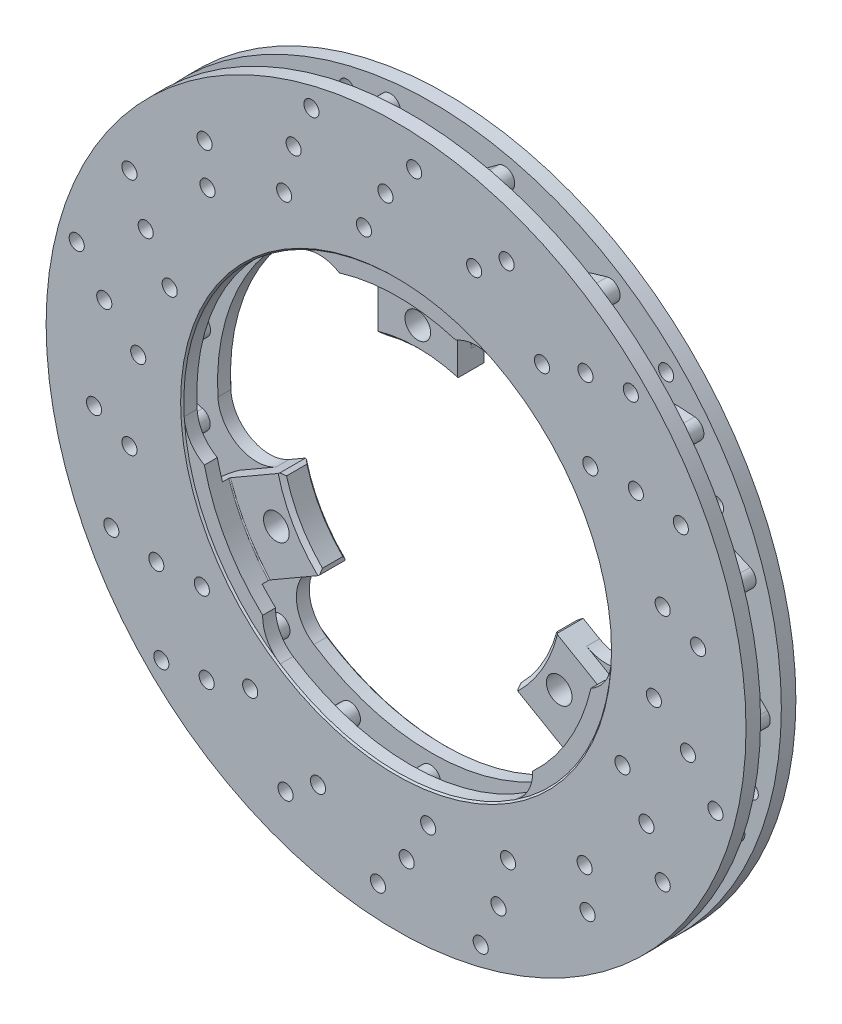
from build123d import *

# Parameters (mm, degrees)
SKETCH2_R                = 90
SKETCH2_R_2              = 55
BOSS_EXTRUDE1_DEPTH      = 6.41
SKETCH2_2_R              = 90
SKETCH2_2_R_2            = 55
CUT_EXTRUDE1_DEPTH       = 2.67
BOSS_EXTRUDE2_START      = -2.67
BOSS_EXTRUDE2_DEPTH      = 9.08
CIRPATTERN1_COUNT        = 18
BOSS_EXTRUDE3_DEPTH      = 3.74
SKETCH5_R                = 1.945
CUT_EXTRUDE2_DEPTH       = 128.440527698
FILLET1_R                = 10
SKETCH6_R                = 1.945
CUT_EXTRUDE3_DEPTH       = 128.440527698
SKETCH7_R                = 1.945
CUT_EXTRUDE4_DEPTH       = 128.440527698
CIRPATTERN2_COUNT        = 6
BOSS_EXTRUDE4_START      = 2.67
BOSS_EXTRUDE4_DEPTH      = 3.74
CIRPATTERN9_COUNT        = 3
FILLET1_OF_CIRPATTERN9_R = 10
REVOLVE6_START           = -2.91
REVOLVE6_DEPTH           = 4
REVOLVE6_START_2         = 0.83
REVOLVE6_2_DEPTH         = 5.58
REVOLVE6_3_OUTLINE_W     = 14.74
REVOLVE6_3_OUTLINE_H     = 0.26
REVOLVE6_4_ANGLE         = 23.19379
CIRPATTERN18_COUNT       = 3
M6_CLEARANCE_HOLE1_D     = 6.6
CIRPATTERN22_COUNT       = 3
CHAMFER2_SIZE            = 1
CHAMFER2_SIZE_2          = 0.804923022
CUT_EXTRUDE5_START       = 6
SKETCH13_R               = 55
CUT_EXTRUDE5_DEPTH       = 122.440527703
CUT_EXTRUDE5_DRAFT       = -45
MIRROR1_START            = 6
MIRROR1_COPY_1_SKETCH_R  = 55
MIRROR1_COPY_1_DEPTH     = 122.440527703
MIRROR1_COPY_1_DRAFT     = -45


with BuildPart() as part:
    # Sketch2 → Boss-Extrude1 (new, symmetric)
    with BuildSketch(Plane.XY):
        Circle(SKETCH2_R)
        Circle(SKETCH2_R_2, mode=Mode.SUBTRACT)
    extrude(amount=BOSS_EXTRUDE1_DEPTH, both=True)

    # Sketch2<2> → Cut-Extrude1 (cut, symmetric)
    with BuildSketch(Plane.XY):
        Circle(SKETCH2_2_R)
        Circle(SKETCH2_2_R_2, mode=Mode.SUBTRACT)
    extrude(amount=CUT_EXTRUDE1_DEPTH, both=True, mode=Mode.SUBTRACT)


with BuildPart() as cut_extrude1_piece_1:
    # of the separate pieces the step leaves, piece 1, a body of its own (cut_extrude1_pieces)
    add(part.part.solids().sort_by_distance((90, 0, -6.41))[0])



with BuildPart() as cut_extrude1_piece_2:
    # of the separate pieces the step leaves, piece 2, a body of its own (cut_extrude1_pieces)
    add(part.part.solids().sort_by_distance((90, 0, 2.67))[0])


with BuildPart() as cut_extrude1_piece_1_1:
    add(cut_extrude1_piece_1.part)

    add(cut_extrude1_piece_2.part)  # Boss-Extrude2 merges Cut-Extrude1 piece 2
    # Sketch3 → Boss-Extrude2 (add)
    with BuildSketch(Plane.XY.offset(BOSS_EXTRUDE2_START)):
        with BuildLine():
            ThreePointArc((-41.15126974, 76.009234535), (-43.25, 60.849603565), (-41.15126974, 45.689972596))
            ThreePointArc((-41.15126974, 45.689972596), (-37.911847701, 43.876855155), (-36.09873026, 47.116277194))
            ThreePointArc((-36.09873026, 47.116277194), (-38, 60.849603565), (-36.09873026, 74.582929936))
            ThreePointArc((-36.09873026, 74.582929936), (-37.911847701, 77.822351975), (-41.15126974, 76.009234535))
        make_face()
    boss_extrude2 = extrude(amount=BOSS_EXTRUDE2_DEPTH)

    # CirPattern1: Boss-Extrude2 ×18 about axis
    cirpattern1_axis = Axis((0, 0, 0), (0, 0, 1))
    for i in range(1, CIRPATTERN1_COUNT):
        add(boss_extrude2.rotate(cirpattern1_axis, i * 360 / CIRPATTERN1_COUNT))

    # Sketch8 → Boss-Extrude3 (add)
    with BuildSketch(Plane(origin=(0, 0, -6.41), x_dir=(-1, 0, 0), z_dir=(0, 0, -1))):
        with BuildLine():
            Line((0, 36), (0, 55))
            ThreePointArc((0, 55), (-5.122262551, 54.760957135), (-10.2, 54.045906413))
            Line((-10.2, 54.045906413), (-10.2, 34.524773714))
            ThreePointArc((-10.2, 34.524773714), (-5.153064443, 35.629284681), (0, 36))
        make_face()
        with BuildLine():
            ThreePointArc((10.2, 54.045906413), (5.122262551, 54.760957135), (0, 55))
            Line((0, 55), (0, 36))
            ThreePointArc((0, 36), (5.153064443, 35.629284681), (10.2, 34.524773714))
            Line((10.2, 34.524773714), (10.2, 54.045906413))
        make_face()
    boss_extrude3 = extrude(amount=-BOSS_EXTRUDE3_DEPTH)

    # Sketch5 → Cut-Extrude2 (cut, symmetric)
    with BuildSketch(Plane.XY):
        with Locations((-28.790841285, 59.944453105)):
            Circle(SKETCH5_R)
        with Locations((-26.343656137, 71.442998895)):
            Circle(SKETCH5_R)
        with Locations((-21.763329137, 82.270088762)):
            Circle(SKETCH5_R)
    cut_extrude2 = extrude(amount=CUT_EXTRUDE2_DEPTH, both=True, mode=Mode.SUBTRACT)

    # Fillet1
    fillet1_edges = [cut_extrude1_piece_1_1.edges().sort_by_distance(p)[0] for p in [
        (10.2, 54.045906413, -4.54),
        (-10.2, 54.045906413, -4.54),
    ]]
    fillet(fillet1_edges, radius=FILLET1_R)

    # Sketch6 → Cut-Extrude3 (cut, symmetric)
    with BuildSketch(Plane.XY):
        with Locations((4.653408879, 81.867855632)):
            Circle(SKETCH6_R)
        with Locations((-8.260237036, 62.456132478)):
            Circle(SKETCH6_R)
        with Locations((-2.727113625, 72.77648504)):
            Circle(SKETCH6_R)
    cut_extrude3 = extrude(amount=CUT_EXTRUDE3_DEPTH, both=True, mode=Mode.SUBTRACT)

    # Sketch7 → Cut-Extrude4 (cut, symmetric)
    with BuildSketch(Plane.XY):
        with Locations((20.076697047, 67.580886615)):
            Circle(SKETCH7_R)
        with Locations((28.426572243, 73.279533231)):
            Circle(SKETCH7_R)
    cut_extrude4 = extrude(amount=CUT_EXTRUDE4_DEPTH, both=True, mode=Mode.SUBTRACT)

    # CirPattern2: Cut-Extrude2, Cut-Extrude3, Cut-Extrude4 ×6 about axis
    cirpattern2_axis = Axis((0, 0, 0), (0, 0, 1))
    add([cut_extrude2.rotate(cirpattern2_axis, i * 360 / CIRPATTERN2_COUNT) for i in range(1, CIRPATTERN2_COUNT)], mode=Mode.SUBTRACT)
    add([cut_extrude3.rotate(cirpattern2_axis, i * 360 / CIRPATTERN2_COUNT) for i in range(1, CIRPATTERN2_COUNT)], mode=Mode.SUBTRACT)
    add([cut_extrude4.rotate(cirpattern2_axis, i * 360 / CIRPATTERN2_COUNT) for i in range(1, CIRPATTERN2_COUNT)], mode=Mode.SUBTRACT)

    # Sketch9 → Boss-Extrude4 (add)
    with BuildSketch(Plane.XY.offset(BOSS_EXTRUDE4_START)):
        with BuildLine():
            ThreePointArc((24.688888889, 49.147316971), (0, 55), (-24.688888889, 49.147316971))
            ThreePointArc((-24.688888889, 49.147316971), (-19.787804533, 50.202942291), (-14.990325394, 48.747206531))
            ThreePointArc((-14.990325394, 48.747206531), (0, 51), (14.990325394, 48.747206531))
            ThreePointArc((14.990325394, 48.747206531), (19.787804533, 50.202942291), (24.688888889, 49.147316971))
        make_face()
    boss_extrude4 = extrude(amount=BOSS_EXTRUDE4_DEPTH)

    # CirPattern9: Boss-Extrude3, Boss-Extrude4 ×3 about axis
    cirpattern9_axis = Axis((0, 0, 0), (0, 0, 1))
    add([boss_extrude3.rotate(cirpattern9_axis, i * 360 / CIRPATTERN9_COUNT) for i in range(1, CIRPATTERN9_COUNT)])
    add([boss_extrude4.rotate(cirpattern9_axis, i * 360 / CIRPATTERN9_COUNT) for i in range(1, CIRPATTERN9_COUNT)])

    # Fillet1 of CirPattern9
    fillet1_of_cirpattern9_edges = [cut_extrude1_piece_1_1.edges().sort_by_distance(p)[0] for p in [
        (-51.905127924, -18.189494088, -4.54),
        (-41.705127924, -35.856412325, -4.54),
        (41.705127924, -35.856412325, -4.54),
        (51.905127924, -18.189494088, -4.54),
    ]]
    fillet(fillet1_of_cirpattern9_edges, radius=FILLET1_OF_CIRPATTERN9_R)


with BuildPart() as body_2:
    # Revolve6: read off the stored shape, not the designer's step
    # Revolve6 outline → Revolve6 (new body)
    with BuildSketch(Plane.XY.offset(REVOLVE6_START)):
        with BuildLine():
            ThreePointArc((10.2, 53.781294146), (0, 54.74), (-10.2, 53.781294146))
            Line((-10.2, 53.781294146), (-10.2, 34.524773714))
            ThreePointArc((-10.2, 34.524773714), (0, 36), (10.2, 34.524773714))
            Line((10.2, 34.524773714), (10.2, 53.781294146))
        make_face()
    extrude(amount=REVOLVE6_DEPTH)

    # Revolve6 2 outline → Revolve6 2 (add)
    with BuildSketch(Plane.XY.offset(REVOLVE6_START_2)):
        with BuildLine():
            ThreePointArc((10.2, 53.781294146), (0, 54.74), (-10.2, 53.781294146))
            Line((-10.2, 53.781294146), (-10.2, 49.969590753))
            ThreePointArc((-10.2, 49.969590753), (0, 51), (10.2, 49.969590753))
            Line((10.2, 49.969590753), (10.2, 53.781294146))
        make_face()
    extrude(amount=REVOLVE6_2_DEPTH)

    # Revolve6 3 outline → Revolve6 3 (revolve, cut)
    with BuildSketch(Plane.XZ):
        with Locations((43.37, 0.96)):
            Rectangle(REVOLVE6_3_OUTLINE_W, REVOLVE6_3_OUTLINE_H)
    revolve(axis=Axis((0, 0, 0), (0, 0, 1)), mode=Mode.SUBTRACT)

    # Revolve6 4 outline → Revolve6 4 (revolve, cut)
    with BuildSketch(Plane(origin=(0, 0, 0), x_dir=(0.2010248324793058, 0.9795861456383849, 0), z_dir=(0.9795861456383849, -0.2010248324793058, 0))):
        with BuildLine():
            Line((54.74, -2.91), (54.74, 1.09))
            ThreePointArc((54.74, 1.09), (53.568427125, -1.738427125), (50.74, -2.91))
            Line((50.74, -2.91), (54.74, -2.91))
        make_face()
        with BuildLine():
            ThreePointArc((50.74, 0.83), (50.923847763, 0.906152237), (51, 1.09))
            Line((51, 1.09), (50.74, 1.09))
            Line((50.74, 1.09), (50.74, 0.83))
        make_face()
    revolve(axis=Axis((0, 0, 0), (0, 0, 1)), revolution_arc=REVOLVE6_4_ANGLE, mode=Mode.SUBTRACT)


with BuildPart() as cirpattern18_1:
    # CirPattern18: pattern copy
    add(body_2.part.rotate(Axis((0, 0, 0), (0, 0, 1)), 1 * 360 / CIRPATTERN18_COUNT))


with BuildPart() as cirpattern18_2:
    # CirPattern18: pattern copy
    add(body_2.part.rotate(Axis((0, 0, 0), (0, 0, 1)), 2 * 360 / CIRPATTERN18_COUNT))


with BuildPart() as body_2_1:
    add(body_2.part)

    # Combine1: union CirPattern18_2, CirPattern18_1, Cut-Extrude1 piece 1
    add(cirpattern18_2.part)
    add(cirpattern18_1.part)
    add(cut_extrude1_piece_1_1.part)

    # M6 Clearance Hole1 (through all)
    with Locations(Plane.XY.offset(0.83)):
        with Locations((0, 42)):
            m6_clearance_hole1 = Hole(M6_CLEARANCE_HOLE1_D / 2)

    # CirPattern22: M6 Clearance Hole1 ×3 about axis
    cirpattern22_axis = Axis((0, 0, 0), (0, 0, 1))
    for i in range(1, CIRPATTERN22_COUNT):
        add(m6_clearance_hole1.rotate(cirpattern22_axis, i * 360 / CIRPATTERN22_COUNT), mode=Mode.SUBTRACT)

    # Chamfer2
    # the kernel refuses this chamfer: 1, 0.804923022 mm, written as the material it takes off along each edge
    with BuildSketch(Plane(origin=(0, 0, 0.83), x_dir=(0.3510643630051463, 0.9363513299119037, 0), z_dir=(0.9363513299119037, -0.3510643630051463, 0))) as chamfer2_piece_1:
        Polygon((36, -CHAMFER2_SIZE), (36 + CHAMFER2_SIZE, 0), (36, 0), align=None)
    revolve(axis=Axis((0, 0, 0.83), (0, 0, 1)), revolution_arc=41.104860261, mode=Mode.SUBTRACT)
    with BuildSketch(Plane(origin=(0, 0, 0.83), x_dir=(0.6353718570684791, -0.7722063216818106, 0), z_dir=(-0.7722063216818106, -0.6353718570684791, 0))) as chamfer2_piece_2:
        Polygon((36, -CHAMFER2_SIZE), (36 + CHAMFER2_SIZE, 0), (36, 0), align=None)
    revolve(axis=Axis((0, 0, 0.83), (0, 0, 1)), revolution_arc=41.104860261, mode=Mode.SUBTRACT)
    with BuildSketch(Plane(origin=(0, 0, -6.41), x_dir=(0.6353718570682565, -0.7722063216819939, 0), z_dir=(-0.7722063216819939, -0.6353718570682565, 0))) as chamfer2_piece_3:
        Polygon((36 + CHAMFER2_SIZE, 0), (36, CHAMFER2_SIZE), (36, 0), align=None)
    revolve(axis=Axis((0, 0, -6.41), (0, 0, 1)), revolution_arc=41.104860261, mode=Mode.SUBTRACT)
    with BuildSketch(Plane(origin=(0, 0, 0.83), x_dir=(-0.9864362200736257, -0.16414500823009323, 0), z_dir=(-0.16414500823009323, 0.9864362200736257, 0))) as chamfer2_piece_4:
        Polygon((36, -CHAMFER2_SIZE), (36 + CHAMFER2_SIZE, 0), (36, 0), align=None)
    revolve(axis=Axis((0, 0, 0.83), (0, 0, 1)), revolution_arc=41.104860261, mode=Mode.SUBTRACT)
    with BuildSketch(Plane(origin=(0, 0, -6.41), x_dir=(-0.9864362200736732, -0.16414500822980876, 0), z_dir=(-0.16414500822980876, 0.9864362200736732, 0))) as chamfer2_piece_5:
        Polygon((36 + CHAMFER2_SIZE, 0), (36, CHAMFER2_SIZE), (36, 0), align=None)
    revolve(axis=Axis((0, 0, -6.41), (0, 0, 1)), revolution_arc=41.104860261, mode=Mode.SUBTRACT)
    with BuildSketch(Plane(origin=(0, 0, -6.41), x_dir=(0.35106436300541644, 0.9363513299118025, 0), z_dir=(0.9363513299118025, -0.35106436300541644, 0))) as chamfer2_piece_6:
        Polygon((36 + CHAMFER2_SIZE, 0), (36, CHAMFER2_SIZE), (36, 0), align=None)
    revolve(axis=Axis((0, 0, -6.41), (0, 0, 1)), revolution_arc=41.104860261, mode=Mode.SUBTRACT)
    with BuildSketch(Plane(origin=(10.2, 34.524773714, 3.438611991), x_dir=(2.6636866476667965e-12, 1.0, 5.287273886688506e-12), z_dir=(1.1465575963401615e-12, 5.2872738866854514e-12, -1.0))) as chamfer2_piece_7:
        with BuildLine():
            Line((CHAMFER2_SIZE_2, 0), (0.273676702, -0.976776668))
            ThreePointArc((0.273676702, -0.976776668), (0.144146887, -0.501240059), (0, 0))
            Line((0, 0), (CHAMFER2_SIZE_2, 0))
        make_face()
    extrude(amount=6.348611991, mode=Mode.SUBTRACT)
    with BuildSketch(Plane(origin=(-10.2, 34.524773714, 3.438611991), x_dir=(0.9629181287205613, 0.2697937682402853, 1.2554300936809476e-13), z_dir=(-1.3355923616025413e-12, 5.232178326960738e-12, -1.0))) as chamfer2_piece_8:
        with BuildLine():
            Line((1.01439223, 0), (CHAMFER2_SIZE_2 * 0.269793768118, -CHAMFER2_SIZE_2 * 0.962918128295))
            Line((CHAMFER2_SIZE_2 * 0.269793768118, -CHAMFER2_SIZE_2 * 0.962918128295), (0, 0))
            ThreePointArc((0, 0), (0.521543071, -0.003570206), (1.01439223, 0))
        make_face()
    extrude(amount=6.348611991, mode=Mode.SUBTRACT)
    with BuildSketch(Plane(origin=(34.999331096, -8.428927738, 3.438611991), x_dir=(0.8660254037859877, -0.4999999999973169, 5.2313623517591795e-12), z_dir=(5.197981082993674e-12, -1.459557370983147e-12, -1.0))) as chamfer2_piece_9:
        with BuildLine():
            Line((CHAMFER2_SIZE_2, 0), (0.273676702, 0.976776668))
            ThreePointArc((0.273676702, 0.976776668), (0.144146887, 0.501240059), (0, 0))
            Line((0, 0), (CHAMFER2_SIZE_2, 0))
        make_face()
    extrude(amount=6.348611991, mode=Mode.SUBTRACT)
    with BuildSketch(Plane(origin=(24.799331096, -26.095845976, 3.438611991), x_dir=(0.7151073214391076, 0.6990146771164285, 3.2208511146153245e-13), z_dir=(4.004877237920565e-12, -3.636306941831101e-12, -1.0))) as chamfer2_piece_10:
        with BuildLine():
            Line((1.01439223, 0), (CHAMFER2_SIZE_2 * 0.269793768118, CHAMFER2_SIZE_2 * 0.962918128295))
            Line((CHAMFER2_SIZE_2 * 0.269793768118, CHAMFER2_SIZE_2 * 0.962918128295), (0, 0))
            ThreePointArc((0, 0), (0.521543071, 0.003570206), (1.01439223, 0))
        make_face()
    extrude(amount=6.348611991, mode=Mode.SUBTRACT)
    with BuildSketch(Plane(origin=(-24.799331096, -26.095845976, -2.91), x_dir=(-0.8660254037828902, -0.5000000000026819, 5.232297368702779e-12), z_dir=(3.863338644834662e-12, 3.7730959176993554e-12, 1.0)), Plane(origin=(-34.999331096, -8.428927738, 3.438611992), x_dir=(-0.8660254037857652, -0.4999999999977023, 5.28734208181295e-12), z_dir=(-5.152384757704256e-12, -1.6504919831325856e-12, -1.0))) as chamfer2_piece_11:
        with BuildLine():
            Line((CHAMFER2_SIZE_2, 0), (0.273676702, -0.976776668))
            ThreePointArc((0.273676702, -0.976776668), (0.144146887, -0.501240059), (0, 0))
            Line((0, 0), (CHAMFER2_SIZE_2, 0))
        make_face()
    extrude(amount=6.348611992, mode=Mode.SUBTRACT)
    with BuildSketch(Plane(origin=(-34.999331096, -8.428927738, -9.018611991), x_dir=(-0.8660254037844384, -0.5000000000000002, 0), z_dir=(0, 0, 1)), Plane(origin=(10.2, 34.524773714, -9.018611991), x_dir=(0, 1, 0), z_dir=(0, 0, 1))) as chamfer2_piece_12:
        with BuildLine():
            Line((CHAMFER2_SIZE_2, 0), (0.273676702, 0.976776668))
            ThreePointArc((0.273676702, 0.976776668), (0.144146887, 0.501240059), (0, 0))
            Line((0, 0), (CHAMFER2_SIZE_2, 0))
        make_face()
    extrude(amount=6.108611991, mode=Mode.SUBTRACT)
    with BuildSketch(Plane(origin=(-24.799331096, -26.095845976, -9.018611991), x_dir=(-0.8660254037844415, -0.4999999999999951, 0), z_dir=(0, 0, 1)), Plane(origin=(34.999331096, -8.428927738, -9.018611991), x_dir=(0.8660254037844383, -0.5000000000000007, 0), z_dir=(0, 0, 1))) as chamfer2_piece_13:
        with BuildLine():
            Line((CHAMFER2_SIZE_2, 0), (0.273676702, -0.976776668))
            ThreePointArc((0.273676702, -0.976776668), (0.144146887, -0.501240059), (0, 0))
            Line((0, 0), (CHAMFER2_SIZE_2, 0))
        make_face()
    extrude(amount=6.108611991, mode=Mode.SUBTRACT)
    with BuildSketch(Plane(origin=(24.799331096, -26.095845976, -9.018611991), x_dir=(0.7151073214604866, 0.6990146770945572, 0), z_dir=(0, 0, 1))) as chamfer2_piece_14:
        with BuildLine():
            Line((1.01439223, 0), (CHAMFER2_SIZE_2 * 0.26979376815, -CHAMFER2_SIZE_2 * 0.962918128286))
            Line((CHAMFER2_SIZE_2 * 0.26979376815, -CHAMFER2_SIZE_2 * 0.962918128286), (0, 0))
            ThreePointArc((0, 0), (0.521543071, -0.003570206), (1.01439223, 0))
        make_face()
    extrude(amount=6.108611991, mode=Mode.SUBTRACT)
    with BuildSketch(Plane(origin=(-10.2, 34.524773714, -9.018611991), x_dir=(0.9629181287123079, 0.2697937682697419, 0), z_dir=(0, 0, 1))) as chamfer2_piece_15:
        with BuildLine():
            Line((1.01439223, 0), (CHAMFER2_SIZE_2 * 0.26979376815, CHAMFER2_SIZE_2 * 0.962918128286))
            Line((CHAMFER2_SIZE_2 * 0.26979376815, CHAMFER2_SIZE_2 * 0.962918128286), (0, 0))
            ThreePointArc((0, 0), (0.521543071, 0.003570206), (1.01439223, 0))
        make_face()
    extrude(amount=6.108611991, mode=Mode.SUBTRACT)


with BuildPart() as cut_extrude5_tool:
    # Sketch13 → Cut-Extrude5 (with draft: the straight prism first)
    with BuildSketch(Plane.XY.offset(CUT_EXTRUDE5_START)):
        Circle(SKETCH13_R)
    extrude(amount=CUT_EXTRUDE5_DEPTH)
    # Cut-Extrude5: the draft: its side faces are tilted about the plane it starts from
    cut_extrude5_sides = [cut_extrude5_tool.faces().sort_by_distance(p)[0] for p in [
        (-55, 0, 67.220263852),
    ]]
    draft(cut_extrude5_sides, Plane.XY.offset(CUT_EXTRUDE5_START), CUT_EXTRUDE5_DRAFT)


with BuildPart() as body_2_2:
    add(body_2_1.part)

    # Cut-Extrude5: cut by cut_extrude5_tool
    add(cut_extrude5_tool.part, mode=Mode.SUBTRACT)


with BuildPart() as mirror1_copy_1_tool:
    # Mirror1 copy 1 sketch → Mirror1 copy 1 (with draft: the straight prism first)
    with BuildSketch(Plane(origin=(0, 0, 0), x_dir=(1, 0, 0), z_dir=(0, 0, -1)).offset(MIRROR1_START)):
        Circle(MIRROR1_COPY_1_SKETCH_R)
    extrude(amount=MIRROR1_COPY_1_DEPTH)
    # Mirror1 copy 1: the draft: its side faces are tilted about the plane it starts from
    mirror1_copy_1_sides = [mirror1_copy_1_tool.faces().sort_by_distance(p)[0] for p in [
        (-55, 0, -67.220263852),
    ]]
    draft(mirror1_copy_1_sides, Plane(origin=(0, 0, 0), x_dir=(1, 0, 0), z_dir=(0, 0, -1)).offset(MIRROR1_START), MIRROR1_COPY_1_DRAFT)


with BuildPart() as body_2_3:
    add(body_2_2.part)

    # Mirror1 copy 1: cut by mirror1_copy_1_tool
    add(mirror1_copy_1_tool.part, mode=Mode.SUBTRACT)


solid = body_2_3.part
